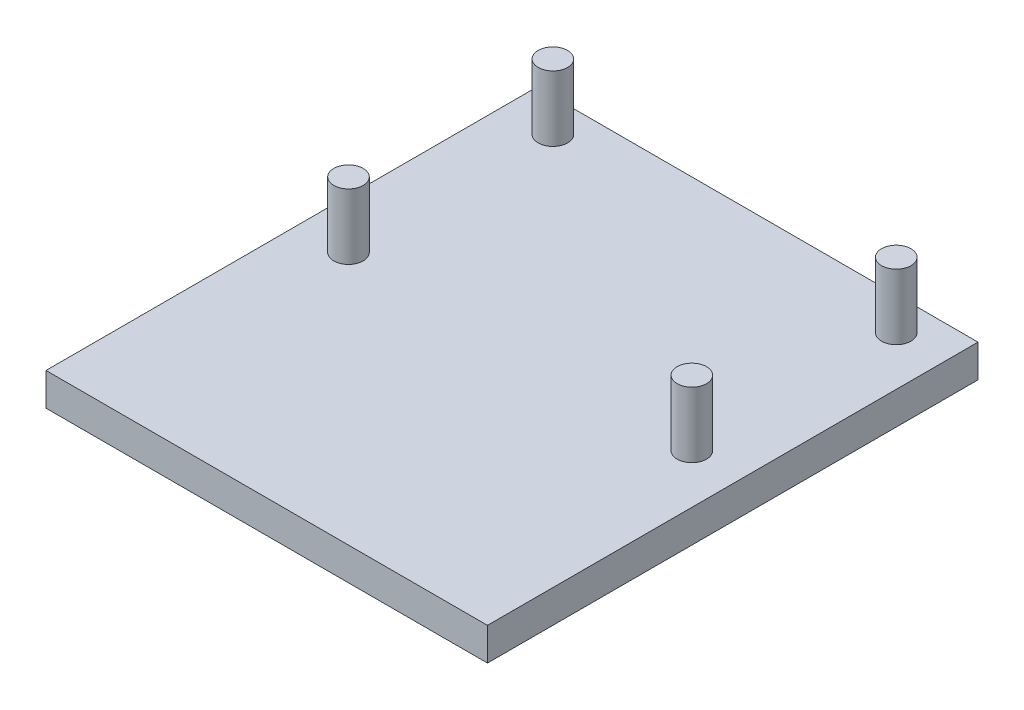
from build123d import *

# Parameters (mm, degrees)
SKETCH3_W           = 27
SKETCH3_H           = 30
BOSS_EXTRUDE1_DEPTH = 2
SKETCH2_R           = 0.9
BOSS_EXTRUDE2_DEPTH = 4


with BuildPart() as part:
    # Sketch3 → Boss-Extrude1 (new body)
    with BuildSketch(Plane(origin=(0, 0, 0), x_dir=(1, 0, 0), z_dir=(0, 1, 0))):
        with Locations((0, -15)):
            Rectangle(SKETCH3_W, SKETCH3_H)
    extrude(amount=-BOSS_EXTRUDE1_DEPTH)

    # Sketch2 → Boss-Extrude2 (add)
    with BuildSketch(Plane(origin=(0, 0, 0), x_dir=(1, 0, 0), z_dir=(0, 1, 0))):
        with Locations((-10.5, -2)):
            Circle(SKETCH2_R)
        with Locations((-10.5, -14.5)):
            Circle(SKETCH2_R)
        with Locations((10.5, -14.5)):
            Circle(SKETCH2_R)
        with Locations((10.5, -2)):
            Circle(SKETCH2_R)
    extrude(amount=BOSS_EXTRUDE2_DEPTH)


solid = part.part
